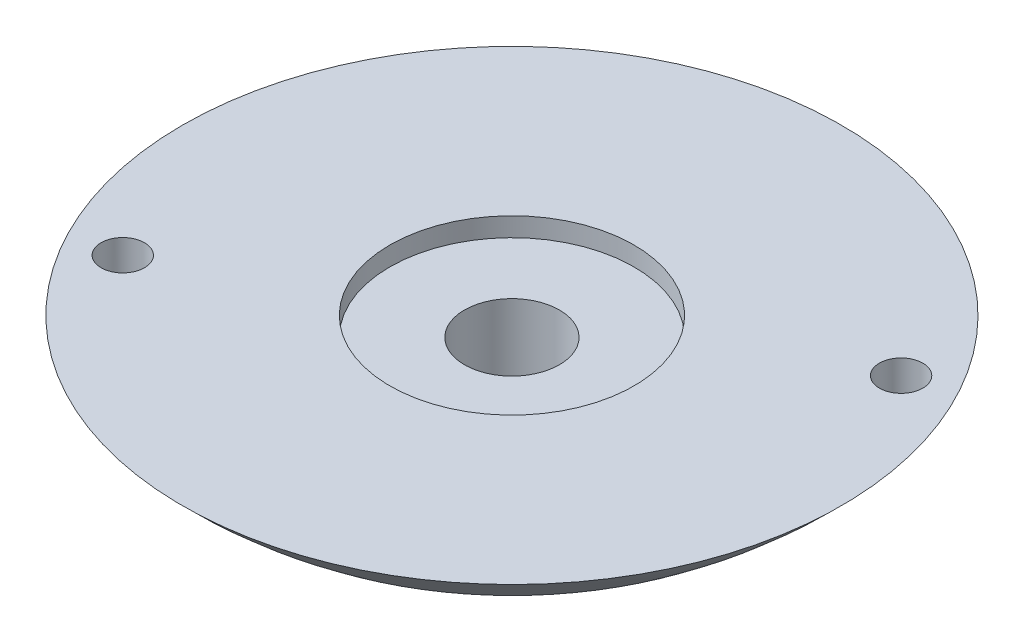
from build123d import *

# Parameters (mm, degrees)
SKETCH2_R                = 33.8
CUT_EXTRUDE1_DEPTH       = 19.1
CUT_EXTRUDE2_START       = -33.8
CUT_EXTRUDE2_DEPTH       = 14.7
BOSS_EXTRUDE2_START      = -1.7
BOSS_EXTRUDE2_DEPTH      = 1.7
SKETCH19_R               = 9
CUT_EXTRUDE10_DEPTH      = 1.4
CUT_EXTRUDE11_REACH      = 42.429
CUT_EXTRUDE11_END_RADIUS = 33.8
SKETCH20_R               = 3.5
CUT_EXTRUDE7_REACH       = 44.024
CUT_EXTRUDE7_END_RADIUS  = 33.8
SKETCH10_R               = 1.6
CUT_EXTRUDE12_REACH      = 42.714
SKETCH21_R               = 27.886018002


# Read off the part's stored shape, not the designer's step: Revolve2
with BuildPart() as part:
    # Sketch1 → Revolve1 (revolve)
    with BuildSketch(Plane.XY, mode=Mode.PRIVATE) as revolve1_sk:
        with BuildLine():
            Line((0, -33.8), (0, 0))
            Line((0, 0), (33.8, 0))
            ThreePointArc((33.8, 0), (23.900209204, -23.900209204), (0, -33.8))
        make_face()
    revolve(revolve1_sk.sketch.rotate(Axis((0, -33.8, 0), (0, 1, 0)), 180), axis=Axis((0, -33.8, 0), (0, 1, 0)))

    # Sketch2 → Cut-Extrude1 (cut)
    with BuildSketch(Plane(origin=(0, 0, 0), x_dir=(1, 0, 0), z_dir=(0, 1, 0))):
        Circle(SKETCH2_R)
    extrude(amount=-CUT_EXTRUDE1_DEPTH, mode=Mode.SUBTRACT)

    # Sketch5 → Cut-Extrude2 (cut)
    with BuildSketch(Plane(origin=(0, 0, 0), x_dir=(1, 0, 0), z_dir=(0, 1, 0)).offset(CUT_EXTRUDE2_START)):
        with BuildLine():
            Line((-17.025732229, 6.571677263), (-23.544283672, 3.742739979))
            ThreePointArc((-23.544283672, 3.742739979), (-23.775794442, 3.633514413), (-24, 3.509985755))
            Line((-24, 3.509985755), (-24, -3.509985755))
            ThreePointArc((-24, -3.509985755), (-23.775794442, -3.633514413), (-23.544283672, -3.742739979))
            Line((-23.544283672, -3.742739979), (-17.025732229, -6.571677263))
            ThreePointArc((-17.025732229, -6.571677263), (0, -18.25), (17.025732229, -6.571677263))
            Line((17.025732229, -6.571677263), (23.544283672, -3.742739979))
            ThreePointArc((23.544283672, -3.742739979), (23.775794442, -3.633514413), (24, -3.509985755))
            Line((24, -3.509985755), (24, 3.509985755))
            ThreePointArc((24, 3.509985755), (23.775794442, 3.633514413), (23.544283672, 3.742739979))
            Line((23.544283672, 3.742739979), (17.025732229, 6.571677263))
            ThreePointArc((17.025732229, 6.571677263), (0, 18.25), (-17.025732229, 6.571677263))
        make_face()
    extrude(amount=CUT_EXTRUDE2_DEPTH, mode=Mode.SUBTRACT)

    # Sketch16 → Boss-Extrude2 (add)
    with BuildSketch(Plane(origin=(0, -19.1, 0), x_dir=(1, 0, 0), z_dir=(0, 1, 0)).offset(BOSS_EXTRUDE2_START)):
        with BuildLine():
            Line((17.025732229, 6.571677263), (23.544283672, 3.742739979))
            ThreePointArc((23.544283672, 3.742739979), (23.775794442, 3.633514413), (24, 3.509985755))
            Line((24, 3.509985755), (24, -3.509985755))
            ThreePointArc((24, -3.509985755), (23.775794442, -3.633514413), (23.544283672, -3.742739979))
            Line((23.544283672, -3.742739979), (17.025732229, -6.571677263))
            ThreePointArc((17.025732229, -6.571677263), (18.25, 0), (17.025732229, 6.571677263))
        make_face()
        with BuildLine():
            Line((-23.544283672, -3.742739979), (-17.025732229, -6.571677263))
            ThreePointArc((-17.025732229, -6.571677263), (-18.25, 0), (-17.025732229, 6.571677263))
            Line((-17.025732229, 6.571677263), (-23.544283672, 3.742739979))
            ThreePointArc((-23.544283672, 3.742739979), (-23.775794442, 3.633514413), (-24, 3.509985755))
            Line((-24, 3.509985755), (-24, -3.509985755))
            ThreePointArc((-24, -3.509985755), (-23.775794442, -3.633514413), (-23.544283672, -3.742739979))
        make_face()
    extrude(amount=BOSS_EXTRUDE2_DEPTH)

    # Revolve2 outline → Revolve2 (revolve)
    with BuildSketch(Plane.XY):
        with BuildLine():
            Line((0, -23.5), (0, -33.8))
            ThreePointArc((0, -33.8), (13.168073663, -31.129436808), (24.255308697, -23.53975361))
            Line((24.255308697, -23.53975361), (24.255308697, -23.5))
            Line((24.255308697, -23.5), (0, -23.5))
        make_face()
    revolve(axis=Axis((0, 0, 0), (0, 1, 0)))

    # Sketch19 → Cut-Extrude10 (cut)
    with BuildSketch(Plane(origin=(0, -23.5, 0), x_dir=(1, 0, 0), z_dir=(0, 1, 0))):
        with Locations(Location((0, 0, 0), (0, 0, 180))):
            Circle(SKETCH19_R)
    extrude(amount=-CUT_EXTRUDE10_DEPTH, mode=Mode.SUBTRACT)

    # Cut-Extrude11: up to this sphere (the profile starts inside it)
    cut_extrude11_end = Location((0, 0, 0)) * Sphere(CUT_EXTRUDE11_END_RADIUS, mode=Mode.PRIVATE)
    # Sketch20 → Cut-Extrude11 (cut, up to the surface)
    with BuildSketch(Plane(origin=(0, -24.9, 0), x_dir=(1, 0, 0), z_dir=(0, 1, 0)), mode=Mode.PRIVATE) as cut_extrude11_sk1:
        with Locations(Location((0, 0, 0), (0, 0, 180))):
            Circle(SKETCH20_R)
    cut_extrude11_tool1 = extrude(cut_extrude11_sk1.sketch, amount=-CUT_EXTRUDE11_REACH, mode=Mode.PRIVATE) & cut_extrude11_end
    add(cut_extrude11_tool1.solids().sort_by_distance((0, -24.9, 0))[0], mode=Mode.SUBTRACT)

    # Cut-Extrude7: up to this sphere (the profile starts inside it)
    cut_extrude7_end = Location((0, 0, 0)) * Sphere(CUT_EXTRUDE7_END_RADIUS, mode=Mode.PRIVATE)
    # Sketch10 → Cut-Extrude7 (cut, up to the surface)
    with BuildSketch(Plane(origin=(0, -19.1, 0), x_dir=(1, 0, 0), z_dir=(0, 1, 0)), mode=Mode.PRIVATE) as cut_extrude7_sk1:
        with Locations(Location((-18.186533479, -10.5, 0), (0, 0, 270))):
            Circle(SKETCH10_R)
    cut_extrude7_tool1 = extrude(cut_extrude7_sk1.sketch, amount=-CUT_EXTRUDE7_REACH, mode=Mode.PRIVATE) & cut_extrude7_end
    add(cut_extrude7_tool1.solids().sort_by_distance((-18.186533, -19.1, 10.5))[0], mode=Mode.SUBTRACT)
    # Sketch10 → Cut-Extrude7 (cut, up to the surface)
    with BuildSketch(Plane(origin=(0, -19.1, 0), x_dir=(1, 0, 0), z_dir=(0, 1, 0)), mode=Mode.PRIVATE) as cut_extrude7_sk2:
        with Locations(Location((18.186533479, 10.5, 0), (0, 0, 270))):
            Circle(SKETCH10_R)
    cut_extrude7_tool2 = extrude(cut_extrude7_sk2.sketch, amount=-CUT_EXTRUDE7_REACH, mode=Mode.PRIVATE) & cut_extrude7_end
    add(cut_extrude7_tool2.solids().sort_by_distance((18.186533, -19.1, -10.5))[0], mode=Mode.SUBTRACT)

    # Sketch21 → Cut-Extrude12 (cut, up to next)
    with BuildSketch(Plane(origin=(0, -23.5, 0), x_dir=(1, 0, 0), z_dir=(0, 1, 0)), mode=Mode.PRIVATE) as cut_extrude12_sk1:
        Circle(SKETCH21_R)
    cut_extrude12_tool1 = extrude(cut_extrude12_sk1.sketch, amount=CUT_EXTRUDE12_REACH, mode=Mode.PRIVATE) & part.part
    add(cut_extrude12_tool1.solids().sort_by_distance((0, -23.5, 0))[0], mode=Mode.SUBTRACT)


solid = part.part
